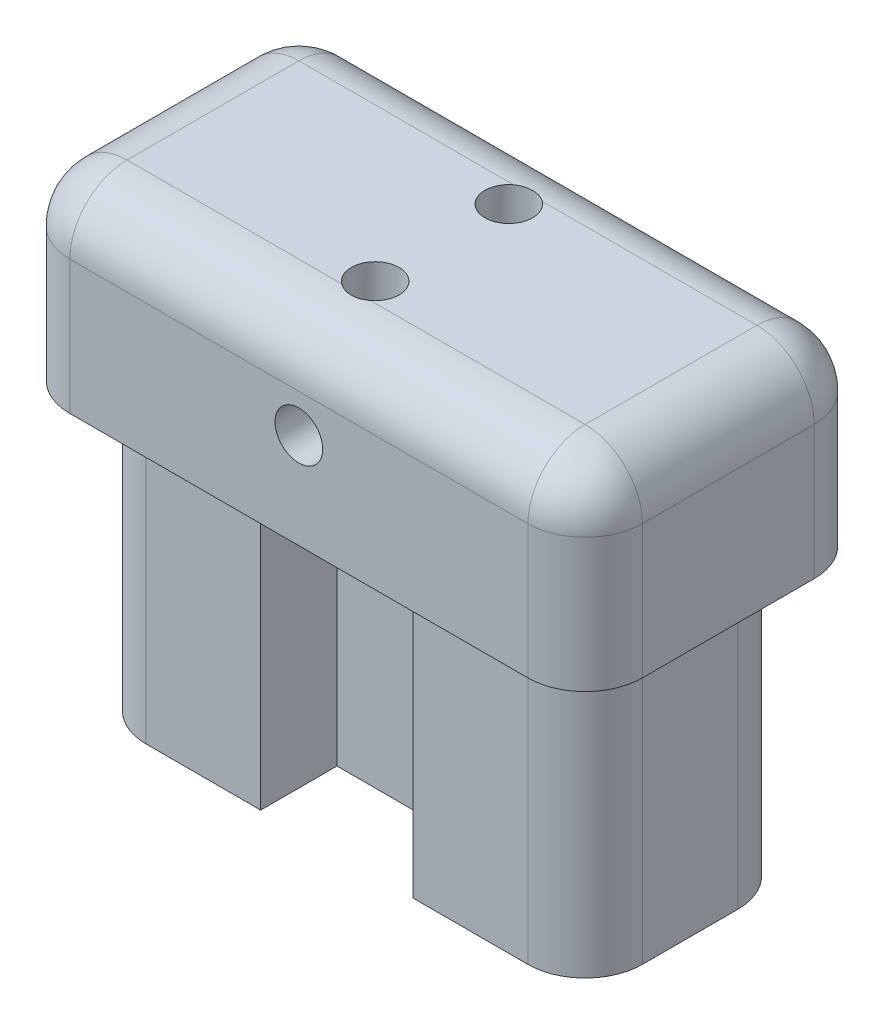
from build123d import *

# Parameters (mm, degrees)
SKETCH1_W           = 30
SKETCH1_H           = 15
BOSS_EXTRUDE1_DEPTH = 10
BOSS_EXTRUDE2_DEPTH = 15
FILLET1_R           = 3
SKETCH3_R           = 1.25
CUT_EXTRUDE1_DEPTH  = 23.5
SKETCH4_R           = 1.25
CUT_EXTRUDE2_DEPTH  = 26.980762171


with BuildPart() as part:
    # Sketch1 → Boss-Extrude1 (new body)
    with BuildSketch(Plane(origin=(0, 0, 0), x_dir=(1, 0, 0), z_dir=(0, 1, 0))):
        Rectangle(SKETCH1_W, SKETCH1_H)
    extrude(amount=BOSS_EXTRUDE1_DEPTH)

    # Sketch2 → Boss-Extrude2 (add)
    with BuildSketch(Plane.XZ):
        Polygon((-13, -5.5), (-4, -5.5), (-4, -1.5), (3.988440582, -1.5), (3.988440582, -5.5), (13, -5.5), (13, 5.5), (3.988440582, 5.5), (3.988440582, 1.5), (-4, 1.5), (-4, 5.5), (-13, 5.5), align=None)
    extrude(amount=BOSS_EXTRUDE2_DEPTH)

    # Fillet1
    fillet1_edges = [part.edges().sort_by_distance(p)[0] for p in [
        (-15, 10, 0),
        (15, 10, 0),
        (0, 10, -7.5),
        (0, 10, 7.5),
        (15, 5, -7.5),
        (15, 5, 7.5),
        (-15, 5, -7.5),
        (-15, 5, 7.5),
        (13, -7.5, -5.5),
        (13, -7.5, 5.5),
        (-13, -7.5, -5.5),
        (-13, -7.5, 5.5),
    ]]
    fillet(fillet1_edges, radius=FILLET1_R)

    # Sketch3 → Cut-Extrude1 (cut, through all)
    with BuildSketch(Plane.XZ):
        with Locations((0, 3.5)):
            Circle(SKETCH3_R)
        with Locations((0, -3.5)):
            Circle(SKETCH3_R)
    extrude(amount=-CUT_EXTRUDE1_DEPTH, mode=Mode.SUBTRACT)

    # Sketch4 → Cut-Extrude2 (cut, through all)
    with BuildSketch(Plane.XY.offset(7.5)):
        with Locations((0, 5)):
            Circle(SKETCH4_R)
    extrude(amount=-CUT_EXTRUDE2_DEPTH, mode=Mode.SUBTRACT)


solid = part.part
